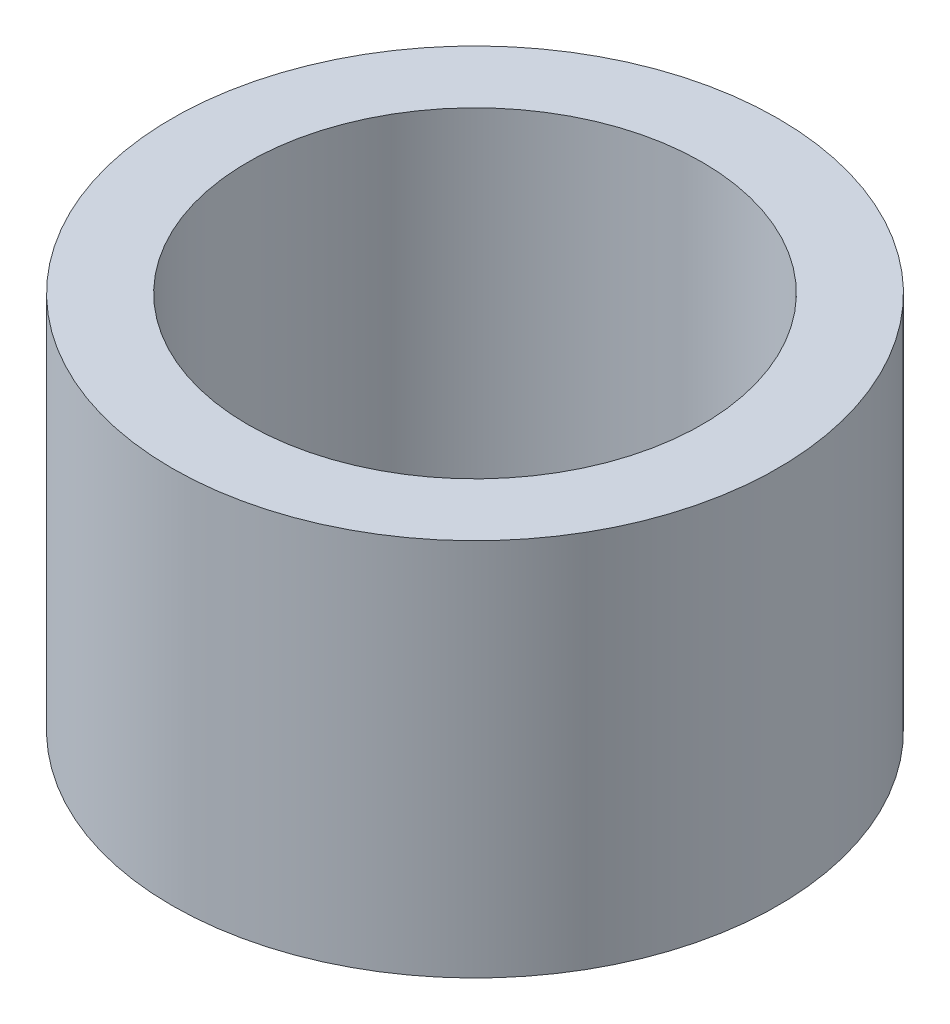
from build123d import *

# Parameters (mm, degrees)
SKETCH_1_R      = 4
SKETCH_1_R_2    = 3
EXTRUDE_1_DEPTH = 5


with BuildPart() as part:
    # Эскиз1 → Бобышка-Вытянуть1 (new body)
    with BuildSketch(Plane(origin=(0, 0, 0), x_dir=(1, 0, 0), z_dir=(0, 1, 0))):
        Circle(SKETCH_1_R)
        Circle(SKETCH_1_R_2, mode=Mode.SUBTRACT)
    extrude(amount=EXTRUDE_1_DEPTH)


solid = part.part
